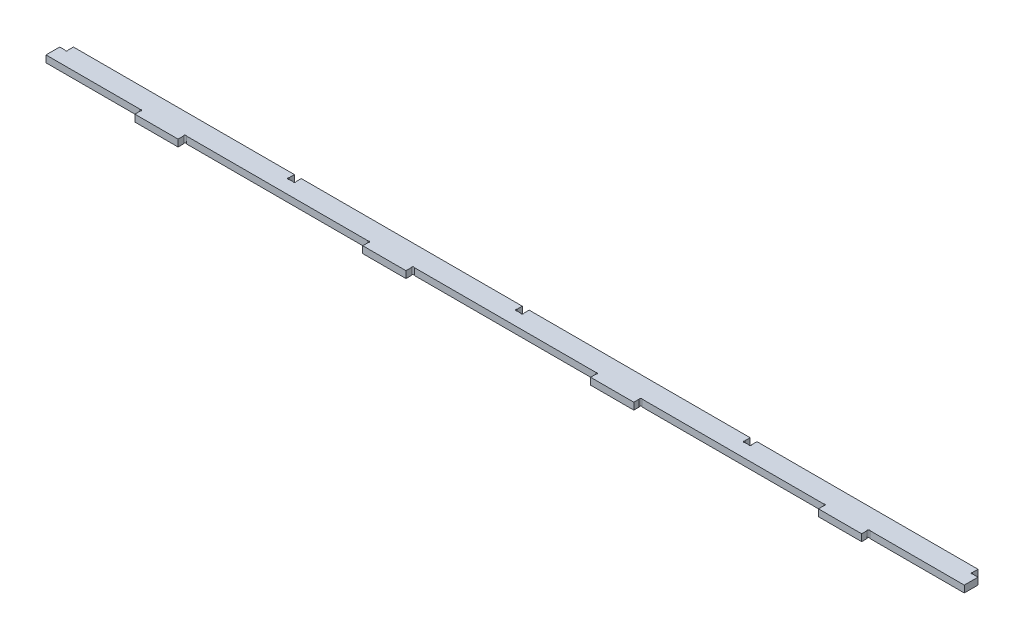
from build123d import *

# Parameters (mm, degrees)
SKETCH1_W             = 425.069
SKETCH1_H             = 9.525
BOSS_EXTRUDE1_DEPTH   = 3.175
SKETCH2_W             = 3.175
SKETCH2_H             = 3.175
CUT_EXTRUDE1_DEPTH    = 213.611560649
SKETCH3_R             = 0.5
CUT_EXTRUDE2_DEPTH    = 213.611560649
SKETCH_PATTERN1_DEPTH = 3.175
SKETCH5_W             = 20
SKETCH5_H             = 3.18
BOSS_EXTRUDE2_DEPTH   = 3.175
SKETCH6_R             = 0.5
CUT_EXTRUDE3_DEPTH    = 213.706552841
SKETCH_PATTERN2_DEPTH = 3.175


# Read off the part's stored shape, not the designer's step: Sketch-Pattern1, Sketch-Pattern2
with BuildPart() as part:
    # Sketch1 → Boss-Extrude1 (new body)
    with BuildSketch(Plane(origin=(0, 0, 0), x_dir=(1, 0, 0), z_dir=(0, 1, 0))):
        Rectangle(SKETCH1_W, SKETCH1_H)
    extrude(amount=BOSS_EXTRUDE1_DEPTH)

    # Sketch2 → Cut-Extrude1 (cut, symmetric)
    with BuildSketch(Plane(origin=(0, 3.175, 0), x_dir=(1, 0, 0), z_dir=(0, 1, 0))):
        with Locations((-105.4735, 3.175)):
            Rectangle(SKETCH2_W, SKETCH2_H)
        with Locations((-210.947, 3.175)):
            Rectangle(SKETCH2_W, SKETCH2_H)
        with Locations((0, 3.175)):
            Rectangle(SKETCH2_W, SKETCH2_H)
    cut_extrude1 = extrude(amount=CUT_EXTRUDE1_DEPTH, both=True, mode=Mode.SUBTRACT)

    # Sketch3 → Cut-Extrude2 (cut, symmetric)
    with BuildSketch(Plane(origin=(0, 3.175, 0), x_dir=(1, 0, 0), z_dir=(0, 1, 0))):
        with Locations((-209.713053391, 1.941053391)):
            Circle(SKETCH3_R)
    cut_extrude2 = extrude(amount=CUT_EXTRUDE2_DEPTH, both=True, mode=Mode.SUBTRACT)

    # Mirror1: Cut-Extrude1 across plane
    add(cut_extrude1.mirror(Plane(origin=(0, 0, 0), x_dir=(0, 0, 1), z_dir=(1, 0, 0))), mode=Mode.SUBTRACT)

    # Sketch-Pattern1 outline → Sketch-Pattern1 (cut)
    with BuildSketch(Plane(origin=(0, 0, 0), x_dir=(1, 0, 0), z_dir=(0, 1, 0))):
        with BuildLine():
            Line((-103.886, 1.5875), (-104.593106781, 1.5875))
            ThreePointArc((-104.593106781, 1.5875), (-104.23955339, 1.441053391), (-103.886, 1.5875))
        make_face()
        with BuildLine():
            Line((-103.886, 2.294606781), (-103.886, 1.5875))
            ThreePointArc((-103.886, 1.5875), (-103.739553391, 1.941053391), (-103.886, 2.294606781))
        make_face()
        with BuildLine():
            Line((107.061, 1.5875), (106.353893219, 1.5875))
            ThreePointArc((106.353893219, 1.5875), (106.70744661, 1.441053391), (107.061, 1.5875))
        make_face()
        with BuildLine():
            Line((107.061, 2.294606781), (107.061, 1.5875))
            ThreePointArc((107.061, 1.5875), (107.207446609, 1.941053391), (107.061, 2.294606781))
        make_face()
        with BuildLine():
            Line((1.5875, 1.5875), (0.880393219, 1.5875))
            ThreePointArc((0.880393219, 1.5875), (1.23394661, 1.441053391), (1.5875, 1.5875))
        make_face()
        with BuildLine():
            Line((1.5875, 2.294606781), (1.5875, 1.5875))
            ThreePointArc((1.5875, 1.5875), (1.733946609, 1.941053391), (1.5875, 2.294606781))
        make_face()
    sketch_pattern1 = extrude(amount=SKETCH_PATTERN1_DEPTH, mode=Mode.SUBTRACT)

    # Mirror2: Cut-Extrude2, Sketch-Pattern1 across plane
    add(cut_extrude2.mirror(Plane(origin=(0, 0, 0), x_dir=(0, 0, 1), z_dir=(1, 0, 0))), mode=Mode.SUBTRACT)
    add(sketch_pattern1.mirror(Plane(origin=(0, 0, 0), x_dir=(0, 0, 1), z_dir=(1, 0, 0))), mode=Mode.SUBTRACT)

    # Sketch5 → Boss-Extrude2 (add)
    with BuildSketch(Plane(origin=(0, 3.175, 0), x_dir=(1, 0, 0), z_dir=(0, 1, 0))):
        with Locations((-158.21025, -6.3525)):
            Rectangle(SKETCH5_W, SKETCH5_H)
        with Locations((-52.73675, -6.3525)):
            Rectangle(SKETCH5_W, SKETCH5_H)
        with Locations((52.73675, -6.3525)):
            Rectangle(SKETCH5_W, SKETCH5_H)
        with Locations((158.21025, -6.3525)):
            Rectangle(SKETCH5_W, SKETCH5_H)
    extrude(amount=-BOSS_EXTRUDE2_DEPTH)

    # Sketch6 → Cut-Extrude3 (cut, symmetric)
    with BuildSketch(Plane(origin=(0, 3.175, 0), x_dir=(1, 0, 0), z_dir=(0, 1, 0))):
        with Locations((-168.563803391, -5.116053391)):
            Circle(SKETCH6_R)
    cut_extrude3 = extrude(amount=CUT_EXTRUDE3_DEPTH, both=True, mode=Mode.SUBTRACT)

    # Sketch-Pattern2 outline → Sketch-Pattern2 (cut)
    with BuildSketch(Plane(origin=(0, 0, 0), x_dir=(1, 0, 0), z_dir=(0, 1, 0))):
        with BuildLine():
            Line((-62.73675, -4.7625), (-62.73675, -5.469606781))
            ThreePointArc((-62.73675, -5.469606781), (-62.590303391, -5.116053391), (-62.73675, -4.7625))
        make_face()
        with BuildLine():
            Line((-63.443856781, -4.7625), (-62.73675, -4.7625))
            ThreePointArc((-62.73675, -4.7625), (-63.09030339, -4.616053391), (-63.443856781, -4.7625))
        make_face()
        with BuildLine():
            Line((148.21025, -4.7625), (148.21025, -5.469606781))
            ThreePointArc((148.21025, -5.469606781), (148.356696609, -5.116053391), (148.21025, -4.7625))
        make_face()
        with BuildLine():
            Line((147.503143219, -4.7625), (148.21025, -4.7625))
            ThreePointArc((148.21025, -4.7625), (147.85669661, -4.616053391), (147.503143219, -4.7625))
        make_face()
        with BuildLine():
            Line((42.73675, -4.7625), (42.73675, -5.469606781))
            ThreePointArc((42.73675, -5.469606781), (42.883196609, -5.116053391), (42.73675, -4.7625))
        make_face()
        with BuildLine():
            Line((42.029643219, -4.7625), (42.73675, -4.7625))
            ThreePointArc((42.73675, -4.7625), (42.38319661, -4.616053391), (42.029643219, -4.7625))
        make_face()
    sketch_pattern2 = extrude(amount=SKETCH_PATTERN2_DEPTH, mode=Mode.SUBTRACT)

    # Mirror3: Cut-Extrude3, Sketch-Pattern2 across plane
    add(cut_extrude3.mirror(Plane(origin=(0, 0, 0), x_dir=(0, 0, 1), z_dir=(1, 0, 0))), mode=Mode.SUBTRACT)
    add(sketch_pattern2.mirror(Plane(origin=(0, 0, 0), x_dir=(0, 0, 1), z_dir=(1, 0, 0))), mode=Mode.SUBTRACT)


solid = part.part
